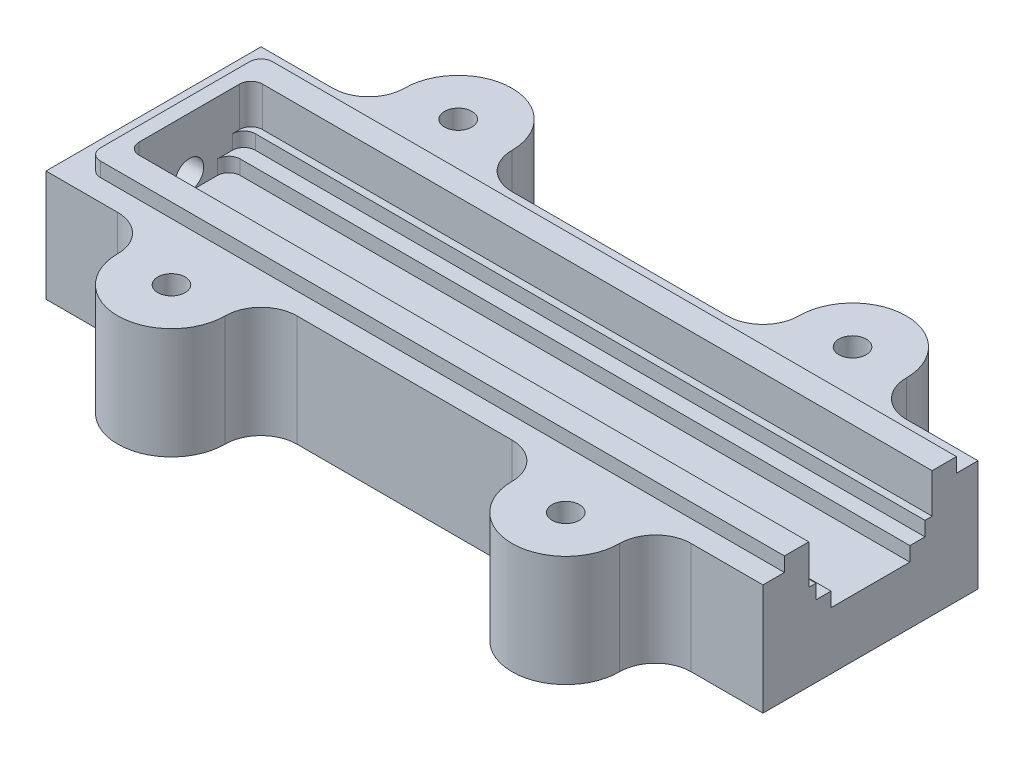
from build123d import *

# Parameters (mm, degrees)
SKETCH1_W           = 100
SKETCH1_H           = 30
BOSS_EXTRUDE1_DEPTH = 20
SKETCH2_W           = 15.2
SKETCH2_H           = 15.5
CUT_EXTRUDE1_DEPTH  = 104.07764064
SKETCH3_W           = 11
SKETCH3_H           = 2
CUT_EXTRUDE2_DEPTH  = 104.07764064
SKETCH4_W           = 1
SKETCH4_H           = 8
CUT_EXTRUDE3_DEPTH  = 104.07764064
CUT_EXTRUDE4_DEPTH  = 104.07764064
BOSS_EXTRUDE2_REACH = 104.622
SKETCH6_W           = 5
SKETCH6_H           = 17.2
FILLET1_R           = 1.5875
FILLET2_R           = 1.5875
SKETCH7_W           = 3
SKETCH7_H           = 24
CUT_EXTRUDE5_DEPTH  = 2
FILLET3_R           = 1.5875
BOSS_EXTRUDE3_DEPTH = 15.5
SKETCH9_R           = 1.905
CUT_EXTRUDE6_DEPTH  = 105.864197894
FILLET4_R           = 5
SKETCH10_R          = 2
CUT_EXTRUDE7_DEPTH  = 101.436547133


# Some blends are built 0.0001 mm under size
with BuildPart() as part:
    # Sketch1 → Boss-Extrude1 (new body)
    with BuildSketch(Plane(origin=(0, 0, 0), x_dir=(1, 0, 0), z_dir=(0, 1, 0))):
        with Locations((50, 0)):
            Rectangle(SKETCH1_W, SKETCH1_H)
    extrude(amount=BOSS_EXTRUDE1_DEPTH)

    # Sketch2 → Cut-Extrude1 (cut, through all)
    with BuildSketch(Plane.ZY):
        with Locations((0, 17.75)):
            Rectangle(SKETCH2_W, SKETCH2_H)
    extrude(amount=-CUT_EXTRUDE1_DEPTH, mode=Mode.SUBTRACT)

    # Sketch3 → Cut-Extrude2 (cut, through all)
    with BuildSketch(Plane.ZY):
        with Locations((0, 9)):
            Rectangle(SKETCH3_W, SKETCH3_H)
    extrude(amount=-CUT_EXTRUDE2_DEPTH, mode=Mode.SUBTRACT)

    # Sketch4 → Cut-Extrude3 (cut, through all)
    with BuildSketch(Plane.ZY):
        with Locations((8.1, 16)):
            Rectangle(SKETCH4_W, SKETCH4_H)
        with Locations((-8.1, 16)):
            Rectangle(SKETCH4_W, SKETCH4_H)
    extrude(amount=-CUT_EXTRUDE3_DEPTH, mode=Mode.SUBTRACT)

    # Sketch5 → Cut-Extrude4 (cut, through all)
    with BuildSketch(Plane(origin=(100, 0, 0), x_dir=(0, 0, -1), z_dir=(1, 0, 0))):
        Polygon((-12, 17.5), (12, 17.5), (12, 15.5), (15, 15.5), (15, 17.5), (15, 20), (-15, 20), (-15, 17.5), (-15, 15.5), (-12, 15.5), align=None)
    extrude(amount=-CUT_EXTRUDE4_DEPTH, mode=Mode.SUBTRACT)

    # Sketch6 → Boss-Extrude2 (add, up to next)
    with BuildSketch(Plane(origin=(0, 17.5, 0), x_dir=(1, 0, 0), z_dir=(0, 1, 0)), mode=Mode.PRIVATE) as boss_extrude2_sk1:
        with Locations((2.5, 0)):
            Rectangle(SKETCH6_W, SKETCH6_H)
    boss_extrude2_tool1 = extrude(boss_extrude2_sk1.sketch, amount=-BOSS_EXTRUDE2_REACH, mode=Mode.PRIVATE) - part.part
    add(boss_extrude2_tool1.solids().sort_by_distance((2.5, 17.5, 0))[0])

    # Fillet1
    fillet1_edges = [part.edges().sort_by_distance(p)[0] for p in [
        (5, 9, 5.5),
        (5, 14.75, 8.6),
        (5, 9, -5.5),
        (5, 14.75, -8.6),
    ]]
    fillet(fillet1_edges, radius=FILLET1_R)

    # Fillet2
    # the kernel refuses this fillet: 1.5875 mm, written as the material it adds along each edge
    with BuildSketch(Plane(origin=(5.11271188, 12, 7.6), x_dir=(1, 0, 0), z_dir=(0, -1, 0))) as fillet2_piece_1:
        with BuildLine():
            CenterArc((1.47478812, -1.5875), FILLET2_R, 90, 90)
            Line((-0.11271188, -1.5875), (-0.27146188, -1.5875))
            ThreePointArc((-0.27146188, -1.5875), (-0.27146188, -0.5875), (-0.147478812, 0.05875))
            Line((-0.147478812, 0.05875), (0, 0.15875))
            Line((0, 0.15875), (1.47478812, 0.15875))
            Line((1.47478812, 0.15875), (1.47478812, 0))
        make_face()
    extrude(amount=5.97874055)
    with BuildSketch(Plane(origin=(5.11271188, 12, -7.6), x_dir=(1, 0, 0), z_dir=(0, -1, 0))) as fillet2_piece_2:
        with BuildLine():
            CenterArc((1.47478812, 1.5875), FILLET2_R, 180, 90)
            Line((-0.11271188, 1.5875), (-0.27146188, 1.5875))
            ThreePointArc((-0.27146188, 1.5875), (-0.27146188, 0.5875), (-0.147478812, -0.05875))
            Line((-0.147478812, -0.05875), (0, -0.15875))
            Line((0, -0.15875), (1.47478812, -0.15875))
            Line((1.47478812, -0.15875), (1.47478812, 0))
        make_face()
    extrude(amount=5.97874055)

    # Sketch7 → Cut-Extrude5 (cut)
    with BuildSketch(Plane(origin=(0, 17.5, 0), x_dir=(1, 0, 0), z_dir=(0, 1, 0))):
        with Locations((1.5, 0)):
            Rectangle(SKETCH7_W, SKETCH7_H)
    extrude(amount=-CUT_EXTRUDE5_DEPTH, mode=Mode.SUBTRACT)

    # Fillet3
    fillet3_edges = [part.edges().sort_by_distance(p)[0] for p in [
        (3, 16.5, 12),
        (3, 16.5, -12),
    ]]
    fillet(fillet3_edges, radius=FILLET3_R)

    # Sketch8 → Boss-Extrude3 (add)
    with BuildSketch(Plane.XZ):
        with BuildLine():
            Line((15, 15), (15, 20))
            ThreePointArc((15, 20), (22.5, 27.5), (30, 20))
            Line((30, 20), (30, 15))
            Line((30, 15), (15, 15))
        make_face()
        with BuildLine():
            Line((70, 15), (70, 20))
            ThreePointArc((70, 20), (77.5, 27.5), (85, 20))
            Line((85, 20), (85, 15))
            Line((85, 15), (70, 15))
        make_face()
    boss_extrude3 = extrude(amount=-BOSS_EXTRUDE3_DEPTH)

    # Mirror1: Boss-Extrude3 across plane
    add(boss_extrude3.mirror(Plane.XY))

    # Sketch9 → Cut-Extrude6 (cut, through all)
    with BuildSketch(Plane(origin=(0, 15.5, 0), x_dir=(1, 0, 0), z_dir=(0, 1, 0))):
        with Locations(Location((22.5, 20, 0), (0, 0, 270))):
            Circle(SKETCH9_R)
        with Locations(Location((77.5, 20, 0), (0, 0, 270))):
            Circle(SKETCH9_R)
        with Locations(Location((77.5, -20, 0), (0, 0, 270))):
            Circle(SKETCH9_R)
        with Locations(Location((22.5, -20, 0), (0, 0, 270))):
            Circle(SKETCH9_R)
    extrude(amount=-CUT_EXTRUDE6_DEPTH, mode=Mode.SUBTRACT)

    # Fillet4
    fillet4_edges = [part.edges().sort_by_distance(p)[0] for p in [
        (15, 7.75, 15),
        (30, 7.75, 15),
        (70, 7.75, 15),
        (85, 7.75, 15),
        (85, 7.75, -15),
        (70, 7.75, -15),
        (30, 7.75, -15),
        (15, 7.75, -15),
    ]]
    fillet(fillet4_edges, radius=FILLET4_R - 0.0001)  # a hair under: the kernel refuses the full size

    # Sketch10 → Cut-Extrude7 (cut, through all)
    with BuildSketch(Plane(origin=(5, 0, 0), x_dir=(0, 0, -1), z_dir=(1, 0, 0))):
        with Locations((0, 10)):
            Circle(SKETCH10_R)
    extrude(amount=-CUT_EXTRUDE7_DEPTH, mode=Mode.SUBTRACT)


solid = part.part
